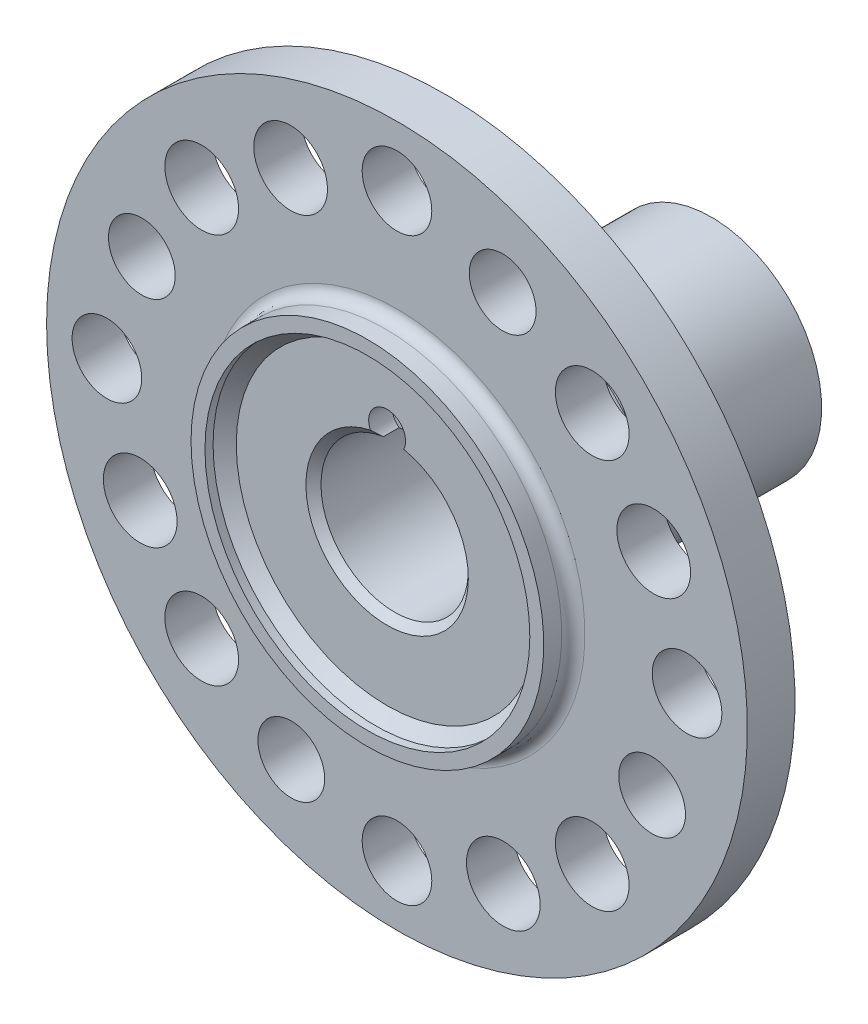
from build123d import *

# Parameters (mm, degrees)
SKETCH11_R              = 6
CUT_EXTRUDE4_DEPTH      = 94.489678575
F_1_2_20_TAPPED_HOLE1_D = 11.50874
SKETCH14_R              = 6.35
CUT_EXTRUDE5_DEPTH      = 94.489678575
SKETCH15_R              = 3.175
CUT_EXTRUDE6_DEPTH      = 4


with BuildPart() as part:
    # Sketch1 → Revolve1 (revolve)
    with BuildSketch(Plane(origin=(0, 0, 0), x_dir=(0, 0, -1), z_dir=(1, 0, 0))):
        with BuildLine():
            Line((0.5, 19), (38, 19))
            Line((38, 19), (38, 18))
            Line((38, 18), (34.1, 14.1))
            Line((34.1, 14.1), (18.3, 14.1))
            Line((18.3, 14.1), (16.9, 12.7))
            Line((16.9, 12.7), (-16.6, 12.7))
            Line((-16.6, 12.7), (-17.9, 14))
            Line((-17.9, 14), (-17.9, 20.7))
            ThreePointArc((-17.9, 20.7), (-18.192893219, 21.407106781), (-18.9, 21.7))
            Line((-18.9, 21.7), (-20.3, 21.7))
            Line((-20.3, 21.7), (-20.3, 23.3))
            ThreePointArc((-20.3, 23.3), (-20.885786438, 24.714213562), (-22.3, 25.3))
            Line((-22.3, 25.3), (-27.5, 25.3))
            Line((-27.5, 25.3), (-27.5, 27.9))
            Line((-27.5, 27.9), (-23.3, 27.9))
            ThreePointArc((-23.3, 27.9), (-21.885786438, 28.485786438), (-21.3, 29.9))
            Line((-21.3, 29.9), (-21.3, 30.4))
            Line((-21.3, 30.4), (-18.2, 30.4))
            ThreePointArc((-18.2, 30.4), (-16.785786438, 30.985786438), (-16.2, 32.4))
            Line((-16.2, 32.4), (-16.2, 60.4))
            Line((-16.2, 60.4), (-8, 60.4))
            Line((-8, 60.4), (-8, 39.3))
            ThreePointArc((-8, 39.3), (-7.853553391, 38.946446609), (-7.5, 38.8))
            Line((-7.5, 38.8), (-7.45, 38.8))
            Line((-7.45, 38.8), (-7.45, 37.7))
            ThreePointArc((-7.45, 37.7), (-6.864213562, 36.285786438), (-5.45, 35.7))
            Line((-5.45, 35.7), (-3.6, 35.7))
            Line((-3.6, 35.7), (-3.6, 28.85))
            Line((-3.6, 28.85), (0, 25.25))
            Line((0, 25.25), (0, 19.5))
            ThreePointArc((0, 19.5), (0.146446609, 19.146446609), (0.5, 19))
        make_face()
    revolve(axis=Axis((0, 0, 0), (0, 0, 1)))

    # Sketch11 → Cut-Extrude4 (cut, through all)
    with BuildSketch(Plane.XY):
        with Locations((0, 50)):
            Circle(SKETCH11_R)
        with Locations((50, 0)):
            Circle(SKETCH11_R)
        with Locations((0, -50)):
            Circle(SKETCH11_R)
        with Locations((-50, 0)):
            Circle(SKETCH11_R)
    extrude(amount=CUT_EXTRUDE4_DEPTH, mode=Mode.SUBTRACT)

    # Sketch7 → LatheCutPocket (revolve, cut)
    with BuildSketch(Plane(origin=(0, 0, 0), x_dir=(0, 0, -1), z_dir=(1, 0, 0))):
        Polygon((-19.9, 28), (-17.9, 26), (-17.9, 0), (-30.163250858, 0), (-30.163250858, 25.3), (-30.163250858, 28), (-30.163250858, 34.511397797), (-21.3, 34.511397797), (-21.3, 28), align=None)
    revolve(axis=Axis((0, 0, 0), (0, 0, 1)), mode=Mode.SUBTRACT)

    # 1/2-20 Tapped Hole1 (through all)
    with Locations(Plane.XY.offset(16.2)):
        with Locations((18.215731381, 43.976665748), (43.976665748, -18.215731381), (-18.215731381, -43.976665748), (-43.976665748, 18.215731381)):
            Hole(F_1_2_20_TAPPED_HOLE1_D / 2)

    # Sketch14 → Cut-Extrude5 (cut, through all)
    with BuildSketch(Plane.XY):
        with Locations((33.658282784, 33.658282784)):
            Circle(SKETCH14_R)
        with Locations((44.254149062, 18.330668733)):
            Circle(SKETCH14_R)
        with Locations((33.658282784, -33.658282784)):
            Circle(SKETCH14_R)
        with Locations((18.330668733, -44.254149062)):
            Circle(SKETCH14_R)
        with Locations((-33.658282784, -33.658282784)):
            Circle(SKETCH14_R)
        with Locations((-44.254149062, -18.330668733)):
            Circle(SKETCH14_R)
        with Locations((-33.658282784, 33.658282784)):
            Circle(SKETCH14_R)
        with Locations((-18.330668733, 44.254149062)):
            Circle(SKETCH14_R)
    extrude(amount=CUT_EXTRUDE5_DEPTH, mode=Mode.SUBTRACT)

    # Sketch15 → Cut-Extrude6 (cut)
    with BuildSketch(Plane.XY.offset(17.9)):
        with Locations((0, 15.075)):
            Circle(SKETCH15_R)
    extrude(amount=-CUT_EXTRUDE6_DEPTH, mode=Mode.SUBTRACT)


solid = part.part
